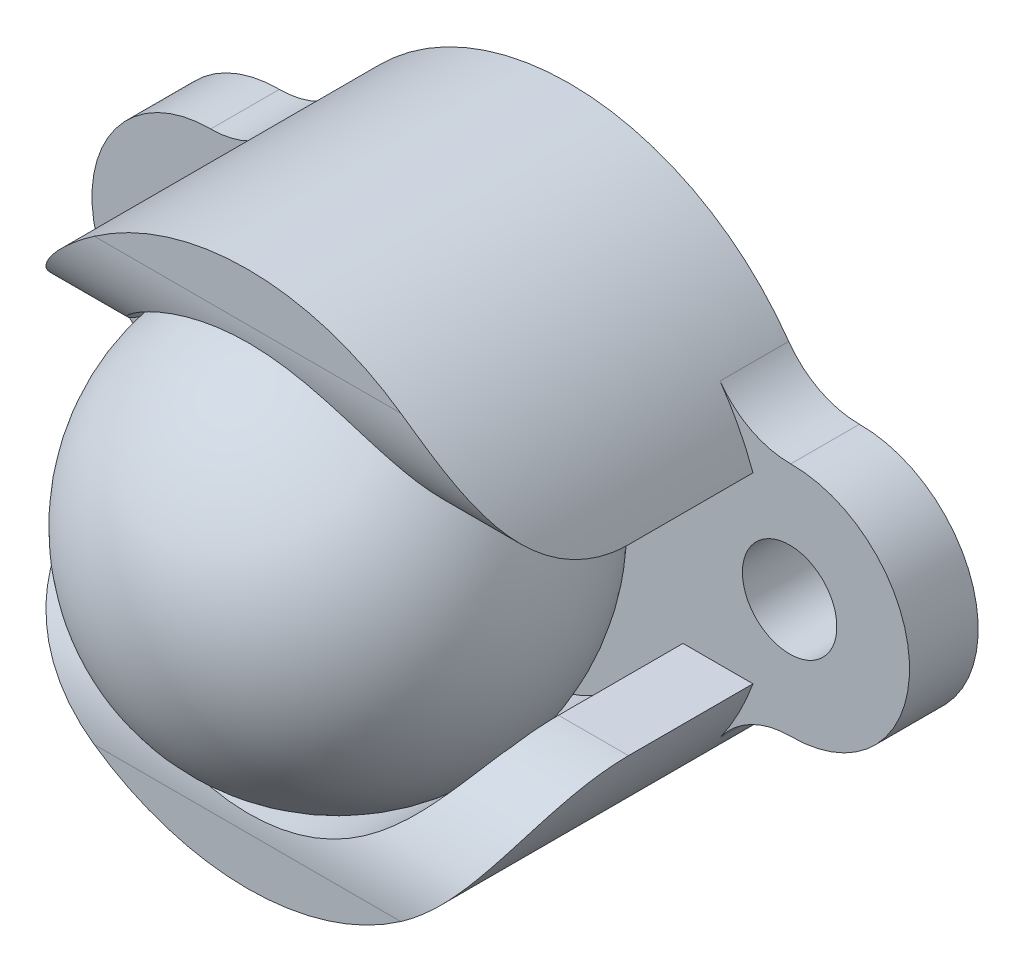
from build123d import *

# Parameters (mm, degrees)
SKETCH1_R           = 6.25
SKETCH1_R_2         = 4.750000000000001
BOSS_EXTRUDE1_DEPTH = 7.5
SKETCH2_R           = 2.9
BOSS_EXTRUDE2_DEPTH = 1.6
SKETCH4_W           = 17.032561562560232
SKETCH4_H           = 4.256966638696863
CUT_EXTRUDE1_DEPTH  = 5.9
FILLET1_R           = 3
SKETCH5_R           = 1.1
SKETCH5_R_2         = 1.0999999999999992
CUT_EXTRUDE2_DEPTH  = 14.63957945649352


with BuildPart() as part:
    # Sketch1 → Boss-Extrude1 (new body)
    with BuildSketch(Plane.XY):
        Circle(SKETCH1_R)
        Circle(SKETCH1_R_2, mode=Mode.SUBTRACT)
    extrude(amount=BOSS_EXTRUDE1_DEPTH)

    # Sketch2 → Boss-Extrude2 (add)
    with BuildSketch(Plane(origin=(0, 0, 0), x_dir=(-1, 0, 0), z_dir=(0, 0, -1))):
        with BuildLine():
            ThreePointArc((-6.757882598562828, 2.7499467257690724), (-9.525000000000002, 3.4e-16), (-6.757882598562828, -2.7499467257690724))
            ThreePointArc((-6.757882598562828, -2.7499467257690724), (-5.829818598679689, -2.9718052821530714), (-5.110176954042268, -3.5984151370256456))
            ThreePointArc((-5.110176954042268, -3.5984151370256456), (3.8e-16, -6.250000000000001), (5.110176954042268, -3.5984151370256447))
            ThreePointArc((5.110176954042268, -3.5984151370256447), (5.829818598679689, -2.9718052821530705), (6.757882598562827, -2.7499467257690715))
            ThreePointArc((6.757882598562827, -2.7499467257690715), (9.525, 0), (6.757882598562827, 2.7499467257690715))
            ThreePointArc((6.757882598562827, 2.7499467257690715), (5.829818598679689, 2.9718052821530705), (5.110176954042268, 3.5984151370256447))
            ThreePointArc((5.110176954042268, 3.5984151370256447), (3.8e-16, 6.25), (-5.110176954042268, 3.5984151370256456))
            ThreePointArc((-5.110176954042268, 3.5984151370256456), (-5.829818598679689, 2.9718052821530714), (-6.757882598562828, 2.7499467257690724))
        make_face()
        Circle(SKETCH2_R, mode=Mode.SUBTRACT)
    extrude(amount=-BOSS_EXTRUDE2_DEPTH)

    # Sketch4 → Cut-Extrude1 (cut)
    with BuildSketch(Plane.XY.offset(7.5)):
        Rectangle(SKETCH4_W, SKETCH4_H)
    extrude(amount=-CUT_EXTRUDE1_DEPTH, mode=Mode.SUBTRACT)

    # Fillet1
    # the kernel refuses this fillet: 3 mm, written as the material it takes off along each edge
    with BuildSketch(Plane(origin=(-13.376398451369308, -2.1284833193484314, 7.5), x_dir=(0, 0, -1), z_dir=(1, 0, 0))) as fillet1_piece_1:
        with BuildLine():
            CenterArc((FILLET1_R, -FILLET1_R), FILLET1_R, 90, 90)
            Line((0, -FILLET1_R), (0, 0))
            Line((0, 0), (FILLET1_R, 0))
        make_face()
    extrude(amount=16.629981284008707, mode=Mode.SUBTRACT)
    with BuildSketch(Plane(origin=(-3.253582832639439, -2.1284833193484314, 7.5), x_dir=(0, -1, 0), z_dir=(1, 0, 0))) as fillet1_piece_2:
        with BuildLine():
            CenterArc((FILLET1_R, FILLET1_R), FILLET1_R, 180, 90)
            Line((0, FILLET1_R), (0, 0))
            Line((0, 0), (FILLET1_R, 0))
        make_face()
    extrude(amount=16.629981284008785, mode=Mode.SUBTRACT)
    with BuildSketch(Plane(origin=(13.376398451369345, 2.1284833193484314, 7.5), x_dir=(0, 0, -1), z_dir=(-1, 0, 0))) as fillet1_piece_3:
        with BuildLine():
            CenterArc((FILLET1_R, -FILLET1_R), FILLET1_R, 90, 90)
            Line((0, -FILLET1_R), (0, 0))
            Line((0, 0), (FILLET1_R, 0))
        make_face()
    extrude(amount=16.629981284008785, mode=Mode.SUBTRACT)
    with BuildSketch(Plane(origin=(3.253582832639398, 2.1284833193484314, 7.5), x_dir=(0, 1, 0), z_dir=(-1, 0, 0))) as fillet1_piece_4:
        with BuildLine():
            CenterArc((FILLET1_R, FILLET1_R), FILLET1_R, 180, 90)
            Line((0, FILLET1_R), (0, 0))
            Line((0, 0), (FILLET1_R, 0))
        make_face()
    extrude(amount=16.629981284008707, mode=Mode.SUBTRACT)

    # Sketch5 → Cut-Extrude2 (cut, through all)
    with BuildSketch(Plane(origin=(0, 0, 0), x_dir=(-1, 0, 0), z_dir=(0, 0, -1))):
        with Locations((-6.731, 0)):
            Circle(SKETCH5_R)
        with Locations((6.731, 0)):
            Circle(SKETCH5_R_2)
    extrude(amount=-CUT_EXTRUDE2_DEPTH, mode=Mode.SUBTRACT)


with BuildPart() as body_2:
    # Sketch6 → Revolve1 (revolve)
    with BuildSketch(Plane(origin=(0, 0, 0), x_dir=(1, 0, 0), z_dir=(0, 1, 0))):
        with BuildLine():
            Line((1.79e-15, -0.6350000000000001), (2.37e-15, -10.16))
            ThreePointArc((2.37e-15, -10.16), (4.762500000000002, -5.3975), (1.79e-15, -0.6350000000000001))
        make_face()
    revolve(axis=Axis((1.79e-15, 0, 0.6350000000000001), (6e-17, 0, 1)))


solid = Compound([part.part, body_2.part])
